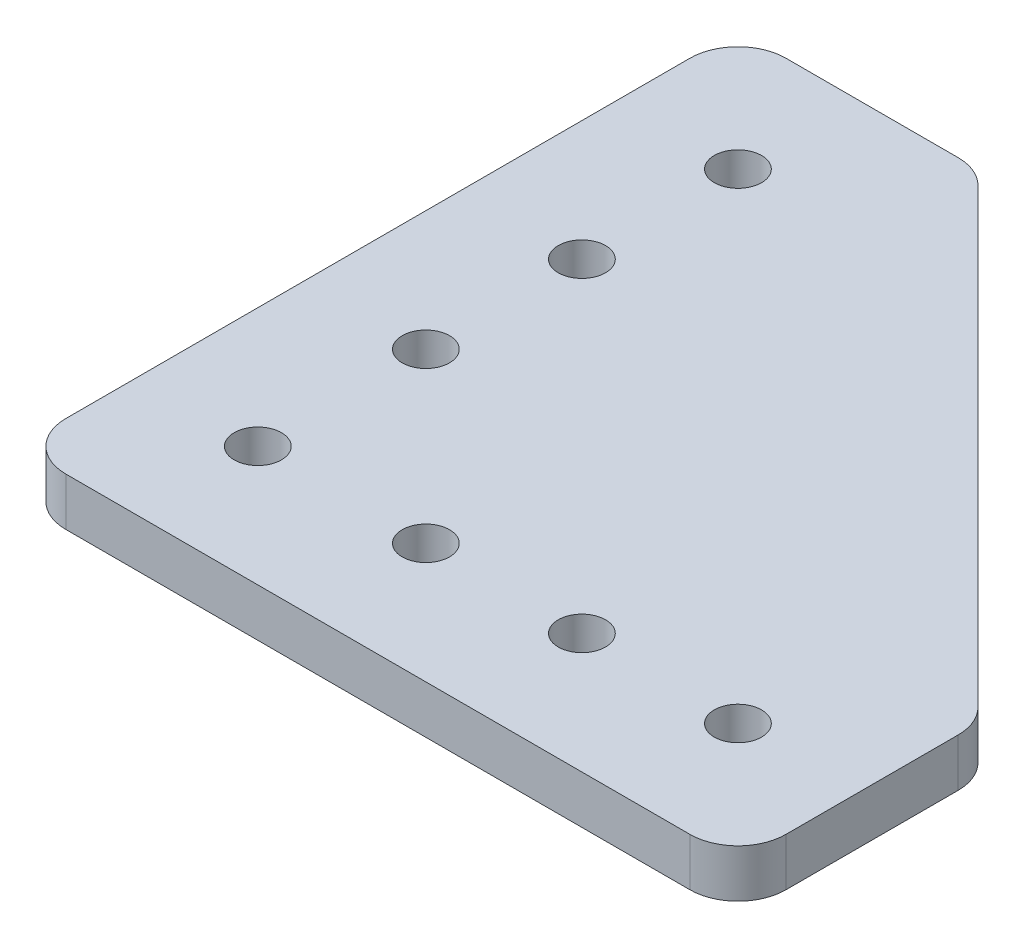
from build123d import *

# Parameters (mm, degrees)
SKETCH1_R           = 2.5
BOSS_EXTRUDE1_DEPTH = 5.08
FILLET1_R           = 5.08
FILLET2_R           = 5.08


with BuildPart() as part:
    # Sketch1 → Boss-Extrude1 (new body)
    with BuildSketch(Plane(origin=(0, 0, 0), x_dir=(1, 0, 0), z_dir=(0, 1, 0))):
        Polygon((0, 0), (0, 76.2), (25.4, 76.2), (76.2, 25.4), (76.2, 0), align=None)
        with Locations((12.7, 63.5)):
            Circle(SKETCH1_R, mode=Mode.SUBTRACT)
        with Locations((63.5, 12.7)):
            Circle(SKETCH1_R, mode=Mode.SUBTRACT)
        with Locations((12.7, 46.99)):
            Circle(SKETCH1_R, mode=Mode.SUBTRACT)
        with Locations((12.7, 30.48)):
            Circle(SKETCH1_R, mode=Mode.SUBTRACT)
        with Locations((46.99, 12.7)):
            Circle(SKETCH1_R, mode=Mode.SUBTRACT)
        with Locations((30.48, 12.7)):
            Circle(SKETCH1_R, mode=Mode.SUBTRACT)
        with Locations((12.7, 12.7)):
            Circle(SKETCH1_R, mode=Mode.SUBTRACT)
    extrude(amount=BOSS_EXTRUDE1_DEPTH)

    # Fillet1
    fillet1_edges = [part.edges().sort_by_distance(p)[0] for p in [
        (0, 2.54, 0),
    ]]
    fillet(fillet1_edges, radius=FILLET1_R)

    # Fillet2
    fillet2_edges = [part.edges().sort_by_distance(p)[0] for p in [
        (25.4, 2.54, -76.2),
        (0, 2.54, -76.2),
        (76.2, 2.54, 0),
        (76.2, 2.54, -25.4),
    ]]
    fillet(fillet2_edges, radius=FILLET2_R)


solid = part.part
